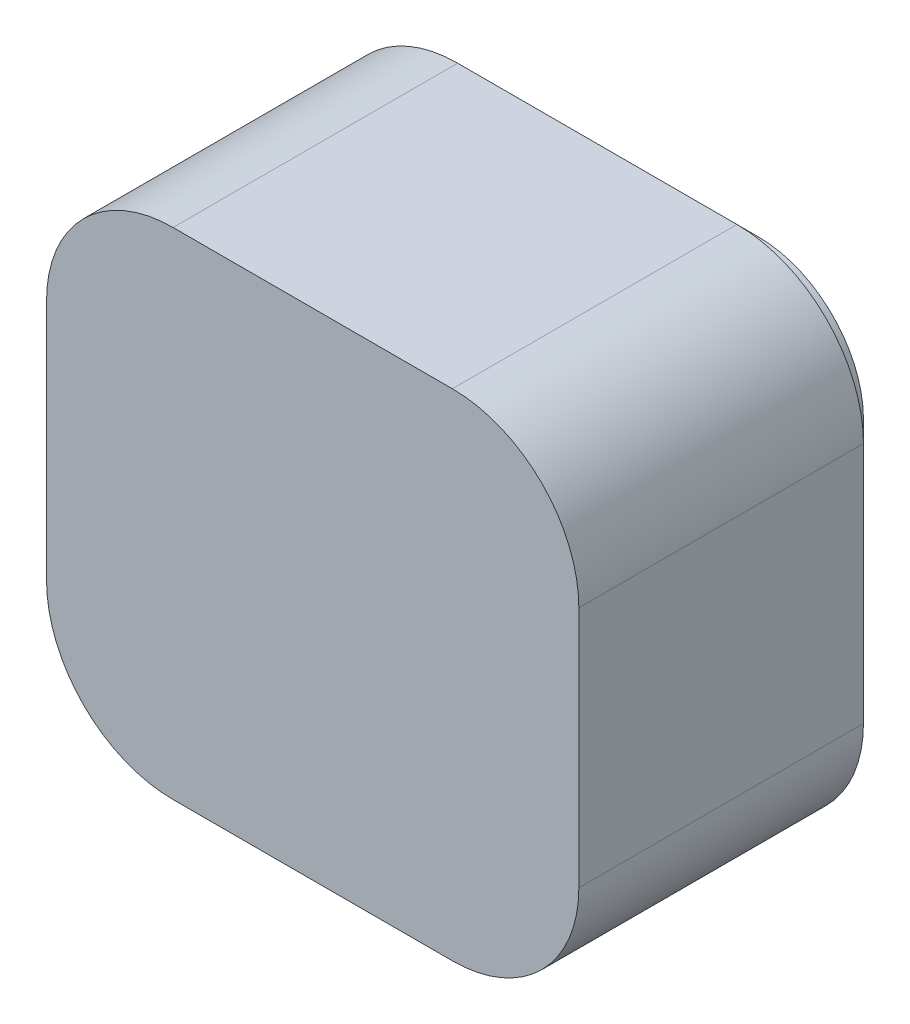
from build123d import *

# Parameters (mm, degrees)
RESSALTO_EXTRUS_O1_DEPTH           = 25
CASCA1_START                       = -36.5
CASCA1_OUTLINE_W                   = 43
CASCA1_OUTLINE_H                   = 25
CASCA1_DEPTH                       = 26.5
CASCA1_2_DEPTH                     = 26.5
CASCA1_3_DEPTH                     = 25
CASCA1_4_DEPTH                     = 27
CASCA1_START_2                     = 25
CASCA1_5_DEPTH                     = 2
RESSALTO_EXTRUS_O2_DEPTH           = 2
RESSALTO_EXTRUS_O2_OTHER_WAY_DEPTH = 2
RESSALTO_EXTRUS_O2_OTHER_WAY_TAPER = 10


with BuildPart() as part:
    # Esboço1 → Ressalto-extrusão1 (new body)
    with BuildSketch(Plane.XY):
        with BuildLine():
            Line((-10, 0), (-36.5, 0))
            ThreePointArc((-36.5, 0), (-43.571067812, 2.928932188), (-46.5, 10))
            Line((-46.5, 10), (-46.5, 33))
            ThreePointArc((-46.5, 33), (-43.571067812, 40.071067812), (-36.5, 43))
            Line((-36.5, 43), (-10, 43))
            ThreePointArc((-10, 43), (-2.928932188, 40.071067812), (0, 33))
            Line((0, 33), (0, 10))
            ThreePointArc((0, 10), (-2.928932188, 2.928932188), (-10, 0))
        make_face()
    extrude(amount=RESSALTO_EXTRUS_O1_DEPTH)

    # Casca1: read off the stored shape, not the designer's step
    # Casca1 outline → Casca1 (cut)
    with BuildSketch(Plane.YZ.offset(CASCA1_START)):
        with Locations((21.5, 12.5)):
            Rectangle(CASCA1_OUTLINE_W, CASCA1_OUTLINE_H)
    extrude(amount=CASCA1_DEPTH, mode=Mode.SUBTRACT)

    # Casca1 2 outline → Casca1 2 (add)
    with BuildSketch(Plane.YZ.offset(CASCA1_START)):
        Polygon((-2, 27), (-2, 0), (0, 0), (0, 25), (43, 25), (43, 0), (45, 0), (45, 27), align=None)
    extrude(amount=CASCA1_2_DEPTH)

    # Casca1 3 outline → Casca1 3 (cut)
    with BuildSketch(Plane.XY):
        with BuildLine():
            Line((-36.5, 0), (-36.5, 43))
            ThreePointArc((-36.5, 43), (-43.571067812, 40.071067812), (-46.5, 33))
            Line((-46.5, 33), (-46.5, 10))
            ThreePointArc((-46.5, 10), (-43.571067812, 2.928932188), (-36.5, 0))
        make_face()
        with BuildLine():
            Line((-10, 43), (-10, 0))
            ThreePointArc((-10, 0), (-2.928932188, 2.928932188), (0, 10))
            Line((0, 10), (0, 33))
            ThreePointArc((0, 33), (-2.928932188, 40.071067812), (-10, 43))
        make_face()
    extrude(amount=CASCA1_3_DEPTH, mode=Mode.SUBTRACT)

    # Casca1 4 outline → Casca1 4 (add)
    with BuildSketch(Plane.XY):
        with BuildLine():
            ThreePointArc((-36.5, 45), (-44.985281374, 41.485281374), (-48.5, 33))
            Line((-48.5, 33), (-48.5, 10))
            ThreePointArc((-48.5, 10), (-44.985281374, 1.514718626), (-36.5, -2))
            Line((-36.5, -2), (-36.5, 0))
            ThreePointArc((-36.5, 0), (-43.571067812, 2.928932188), (-46.5, 10))
            Line((-46.5, 10), (-46.5, 33))
            ThreePointArc((-46.5, 33), (-43.571067812, 40.071067812), (-36.5, 43))
            Line((-36.5, 43), (-36.5, 45))
        make_face()
        with BuildLine():
            ThreePointArc((-10, -2), (-1.514718626, 1.514718626), (2, 10))
            Line((2, 10), (2, 33))
            ThreePointArc((2, 33), (-1.514718626, 41.485281374), (-10, 45))
            Line((-10, 45), (-10, 43))
            ThreePointArc((-10, 43), (-2.928932188, 40.071067812), (0, 33))
            Line((0, 33), (0, 10))
            ThreePointArc((0, 10), (-2.928932188, 2.928932188), (-10, 0))
            Line((-10, 0), (-10, -2))
        make_face()
    extrude(amount=CASCA1_4_DEPTH)

    # Casca1 5 outline → Casca1 5 (add)
    with BuildSketch(Plane.XY.offset(CASCA1_START_2)):
        with BuildLine():
            Line((-36.5, 0), (-36.5, 43))
            ThreePointArc((-36.5, 43), (-43.571067812, 40.071067812), (-46.5, 33))
            Line((-46.5, 33), (-46.5, 10))
            ThreePointArc((-46.5, 10), (-43.571067812, 2.928932188), (-36.5, 0))
        make_face()
        with BuildLine():
            Line((-10, 43), (-10, 0))
            ThreePointArc((-10, 0), (-2.928932188, 2.928932188), (0, 10))
            Line((0, 10), (0, 33))
            ThreePointArc((0, 33), (-2.928932188, 40.071067812), (-10, 43))
        make_face()
    extrude(amount=CASCA1_5_DEPTH)



with BuildPart() as body_2:
    # Esboço6 → Ressalto-extrusão2 (new body)
    with BuildSketch(Plane.XY):
        with BuildLine():
            ThreePointArc((-10, 0), (-2.928932188, 2.928932188), (0, 10))
            Line((0, 10), (0, 33))
            ThreePointArc((0, 33), (-2.928932188, 40.071067812), (-10, 43))
            Line((-10, 43), (-36.5, 43))
            ThreePointArc((-36.5, 43), (-43.571067812, 40.071067812), (-46.5, 33))
            Line((-46.5, 33), (-46.5, 10))
            ThreePointArc((-46.5, 10), (-43.571067812, 2.928932188), (-36.5, 0))
            Line((-36.5, 0), (-10, 0))
        make_face()
    extrude(amount=-RESSALTO_EXTRUS_O2_DEPTH)


with BuildPart() as part_1:
    add(part.part)

    add(body_2.part)  # Ressalto-extrusão2 other way merges body 2
    # Esboço6 → Ressalto-extrusão2 other way (add)
    with BuildSketch(Plane.XY):
        with BuildLine():
            ThreePointArc((-10, 0), (-2.928932188, 2.928932188), (0, 10))
            Line((0, 10), (0, 33))
            ThreePointArc((0, 33), (-2.928932188, 40.071067812), (-10, 43))
            Line((-10, 43), (-36.5, 43))
            ThreePointArc((-36.5, 43), (-43.571067812, 40.071067812), (-46.5, 33))
            Line((-46.5, 33), (-46.5, 10))
            ThreePointArc((-46.5, 10), (-43.571067812, 2.928932188), (-36.5, 0))
            Line((-36.5, 0), (-10, 0))
        make_face()
    extrude(amount=RESSALTO_EXTRUS_O2_OTHER_WAY_DEPTH, taper=RESSALTO_EXTRUS_O2_OTHER_WAY_TAPER)


solid = part_1.part
